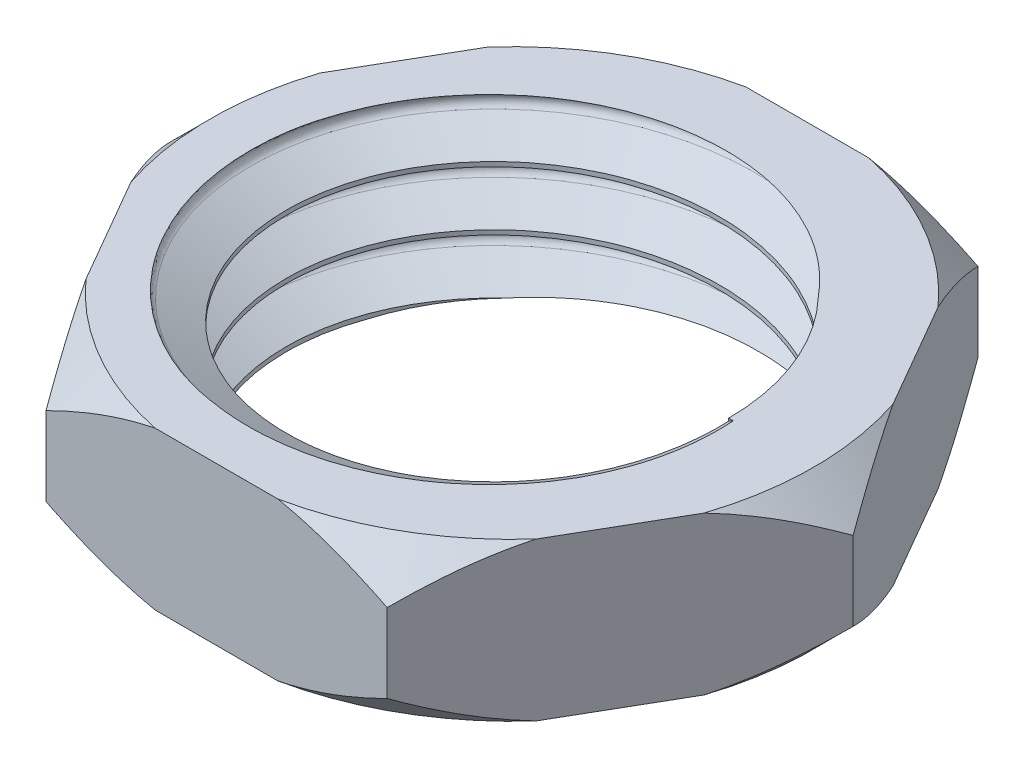
from build123d import *

# Parameters (mm, degrees)
SKETCH5_R           = 5.5
BOSS_EXTRUDE6_DEPTH = 4
CUT_SWEEP2_PITCH    = 1.5


with BuildPart() as part:
    # Sketch5 → Boss-Extrude6 (new body)
    with BuildSketch(Plane(origin=(0, 0, 0), x_dir=(1, 0, 0), z_dir=(0, 1, 0))):
        Polygon((8.660254038, 0), (4.330127019, 7.5), (-4.330127019, 7.5), (-8.660254038, 0), (-4.330127019, -7.5), (4.330127019, -7.5), align=None)
        with Locations(Location((0, 0, 0), (0, 0, 270))):
            Circle(SKETCH5_R, mode=Mode.SUBTRACT)
    extrude(amount=BOSS_EXTRUDE6_DEPTH)

    # Cut-Sweep2: the profile of Sketch8 profile screwed along a right-hand helix of 3.75 turns, 8 arcs to a turn; built about Z, then put on its axis
    cut_sweep2_z = Axis((0, 0, 0), (0, 0, 1))
    cut_sweep2_corners = [(6.4, 0, 0.173205081), (5.4997, 0, 0.692993528), (5.4997, 0, -0.692993528), (6.4, 0, -0.173205081), (6.5, 0, 0)]
    with BuildLine(mode=Mode.PRIVATE) as cut_sweep2_profile:
        Line(cut_sweep2_corners[0], cut_sweep2_corners[1])
        Line(cut_sweep2_corners[1], cut_sweep2_corners[2])
        Line(cut_sweep2_corners[2], cut_sweep2_corners[3])
        ThreePointArc((6.4, 0, -0.173205081), (6.473205081, 0, -0.1), (6.5, 0, 0))
        ThreePointArc((6.5, 0, 0), (6.473205081, 0, 0.1), (6.4, 0, 0.173205081))
    cut_sweep2_cap = Face(cut_sweep2_profile.wire())
    cut_sweep2_arcs = [((6.4, 0, -0.173205081), (6.5, 0, -0.115470054), (6.5, 0, 0), (1, 0.8660254037844393, 1)), ((6.5, 0, 0), (6.5, 0, 0.115470054), (6.4, 0, 0.173205081), (1, 0.8660254037844393, 1))]  # start, shoulder, end, weights
    cut_sweep2_turn_angles = [0, 22.5, 45, 67.5, 90, 112.5, 135, 157.5, 180, 202.5, 225, 247.5, 270, 292.5, 315, 337.5, 360]
    cut_sweep2_turn_weights = [1, 0.9238795325112867, 1, 0.9238795325112867, 1, 0.9238795325112867, 1, 0.9238795325112867, 1, 0.9238795325112867, 1, 0.9238795325112867, 1, 0.9238795325112867, 1, 0.9238795325112867, 1]
    cut_sweep2_turn_rails = [Edge.make_bspline([Vector(p[0], p[1], 0).rotate(cut_sweep2_z, cut_sweep2_turn_angles[k]) / cut_sweep2_turn_weights[k] + Vector(0, 0, p[2] + CUT_SWEEP2_PITCH * cut_sweep2_turn_angles[k] / 360) for k in range(17)], [0, 0, 0, 1, 1, 2, 2, 3, 3, 4, 4, 5, 5, 6, 6, 7, 7, 8, 8, 8], 2, cut_sweep2_turn_weights) for p in cut_sweep2_corners]
    cut_sweep2_turn_sides = [*[Face.make_surface_from_curves(cut_sweep2_turn_rails[p[0]], cut_sweep2_turn_rails[p[1]]) for p in [(0, 1), (1, 2), (2, 3)]], *[Face.make_bezier_surface([[Vector(p[j][0], p[j][1], 0).rotate(cut_sweep2_z, cut_sweep2_turn_angles[2 * i + k]) / cut_sweep2_turn_weights[2 * i + k] + Vector(0, 0, p[j][2] + CUT_SWEEP2_PITCH * cut_sweep2_turn_angles[2 * i + k] / 360) for k in range(3)] for j in range(3)], [[p[3][j] * cut_sweep2_turn_weights[2 * i + k] for k in range(3)] for j in range(3)]) for p in cut_sweep2_arcs for i in range(8)]]
    cut_sweep2_last_angles = [1080, 1102.5, 1125, 1147.5, 1170, 1192.5, 1215, 1237.5, 1260, 1282.5, 1305, 1327.5, 1350]
    cut_sweep2_last_weights = [1, 0.9238795325112867, 1, 0.9238795325112867, 1, 0.9238795325112867, 1, 0.9238795325112867, 1, 0.9238795325112867, 1, 0.9238795325112731, 1]
    cut_sweep2_last_rails = [Edge.make_bspline([Vector(p[0], p[1], 0).rotate(cut_sweep2_z, cut_sweep2_last_angles[k]) / cut_sweep2_last_weights[k] + Vector(0, 0, p[2] + CUT_SWEEP2_PITCH * cut_sweep2_last_angles[k] / 360) for k in range(13)], [0, 0, 0, 1, 1, 2, 2, 3, 3, 4, 4, 5, 5, 6, 6, 6], 2, cut_sweep2_last_weights) for p in cut_sweep2_corners]
    cut_sweep2_last_sides = [*[Face.make_surface_from_curves(cut_sweep2_last_rails[p[0]], cut_sweep2_last_rails[p[1]]) for p in [(0, 1), (1, 2), (2, 3)]], *[Face.make_bezier_surface([[Vector(p[j][0], p[j][1], 0).rotate(cut_sweep2_z, cut_sweep2_last_angles[2 * i + k]) / cut_sweep2_last_weights[2 * i + k] + Vector(0, 0, p[j][2] + CUT_SWEEP2_PITCH * cut_sweep2_last_angles[2 * i + k] / 360) for k in range(3)] for j in range(3)], [[p[3][j] * cut_sweep2_last_weights[2 * i + k] for k in range(3)] for j in range(3)]) for p in cut_sweep2_arcs for i in range(6)]]
    cut_sweep2 = Plane(origin=(0, -1, 0), x_dir=(0, 0, -1), z_dir=(0, 1, 0)) * Solid(Shell([*[p.moved(Location((0, 0, CUT_SWEEP2_PITCH * i))) for i in range(3) for p in cut_sweep2_turn_sides], *cut_sweep2_last_sides, cut_sweep2_cap, cut_sweep2_cap.rotate(cut_sweep2_z, 1350).moved(Location((0, 0, CUT_SWEEP2_PITCH * 1350 / 360)))]))
    add(cut_sweep2, mode=Mode.SUBTRACT)

    # Sketch10 → Cut-Revolve1 (revolve, cut)
    with BuildSketch(Plane.XY):
        Polygon((7.660254038, 4), (8.660254038, 3), (8.660254038, 1), (7.660254038, 0), (10.104481356, 0), (10.104481356, 4), align=None)
    revolve(axis=Axis((0, 0, 0), (0, 1, 0)), mode=Mode.SUBTRACT)


solid = part.part
